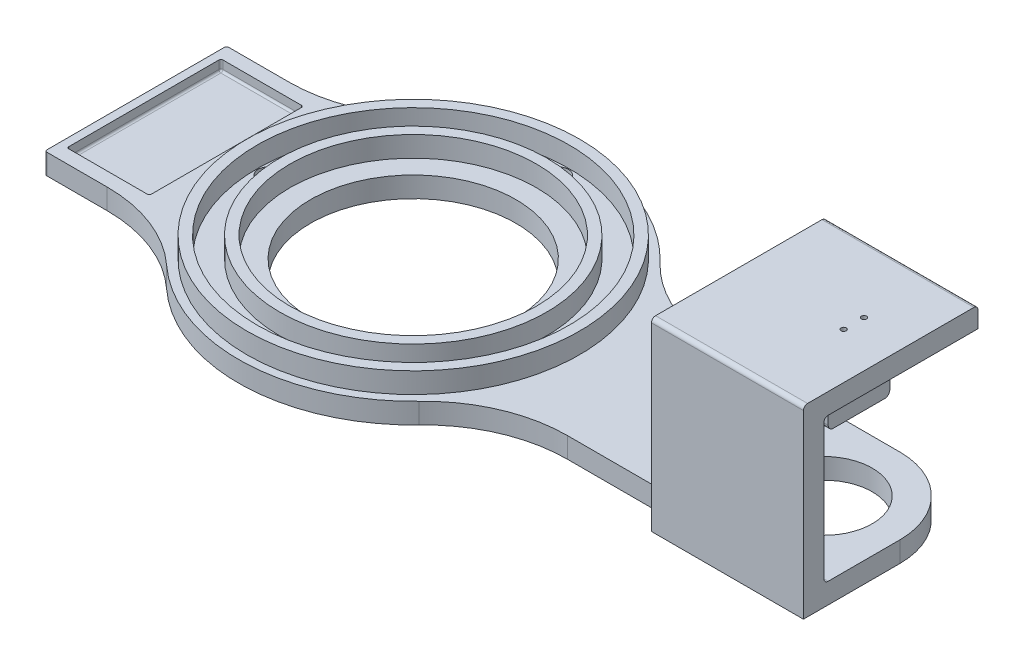
from build123d import *

# Parameters (mm, degrees)
CROQUIS1_R                   = 50
CROQUIS1_R_2                 = 23.5
SALIENTE_EXTRUIR1_DEPTH      = 10
REDONDEO1_R                  = 70
CROQUIS2_R                   = 81
CROQUIS2_R_2                 = 76
SALIENTE_EXTRUIR2_DEPTH      = 10
CROQUIS8_W                   = 74
CROQUIS8_H                   = 10
SALIENTE_EXTRUIR4_DEPTH      = 10
CROQUIS9_W                   = 74
CROQUIS9_H                   = 10
SALIENTE_EXTRUIR5_DEPTH      = 80
CROQUIS10_W                  = 74
CROQUIS10_H                  = 10
SALIENTE_EXTRUIR6_DEPTH      = 75
REDONDEO3_R                  = 2
REDONDEO4_R                  = 2
REDONDEO5_R                  = 2
REDONDEO6_R                  = 2
CROQUIS12_R                  = 65
CROQUIS12_R_2                = 60
SALIENTE_EXTRUIR12_DEPTH     = 10
CROQUIS13_R                  = 5
CORTAR_EXTRUIR1_DEPTH        = 10
SALIENTE_EXTRUIR13_OUTLINE_R = 1.25
SALIENTE_EXTRUIR13_DEPTH     = 26.7
REDONDEO7_R                  = 10
CORTAR_EXTRUIR2_START        = -36.7
CROQUIS15_R                  = 1.25
CORTAR_EXTRUIR2_DEPTH        = 36.7
REDONDEO9_R                  = 2.5
CROQUIS17_W                  = 7
CROQUIS17_H                  = 5
CORTAR_EXTRUIR3_DEPTH        = 26.95
CROQUIS18_W                  = 40.143208987
CROQUIS18_H                  = 75
CORTAR_EXTRUIR4_DEPTH        = 5
REDONDEO10_R                 = 1
REDONDEO11_R                 = 1


# Read off the part's stored shape, not the designer's step: Saliente-Extruir13
with BuildPart() as part:
    # Croquis1 → Saliente-Extruir1 (new body)
    with BuildSketch(Plane(origin=(0, 0, 0), x_dir=(1, 0, 0), z_dir=(0, 1, 0))):
        with BuildLine():
            ThreePointArc((-72.570488149, -44.255217205), (4.131356705, -84.899539997), (76.524505879, -37))
            Line((76.524505879, -37), (237, -37))
            Line((237, -37), (237, 0))
            ThreePointArc((237, 0), (226.162950904, 26.162950904), (200, 37))
            Line((200, 37), (76.524505879, 37))
            ThreePointArc((76.524505879, 37), (4.131356705, 84.899539997), (-72.570488149, 44.255217205))
            Line((-72.570488149, 44.255217205), (-135.143208987, 44.255217205))
            Line((-135.143208987, 44.255217205), (-135.143208987, -44.255217205))
            Line((-135.143208987, -44.255217205), (-72.570488149, -44.255217205))
        make_face()
        with Locations(Location((0, 0, 0), (0, 0, 270))):
            Circle(CROQUIS1_R, mode=Mode.SUBTRACT)
        with Locations(Location((200, 0, 0), (0, 0, 270))):
            Circle(CROQUIS1_R_2, mode=Mode.SUBTRACT)
    extrude(amount=SALIENTE_EXTRUIR1_DEPTH)

    # Redondeo1
    redondeo1_edges = [part.edges().sort_by_distance(p)[0] for p in [
        (76.524505879, 5, 37),
        (-72.570488149, 5, 44.255217205),
        (-72.570488149, 5, -44.255217205),
        (76.524505879, 5, -37),
    ]]
    fillet(redondeo1_edges, radius=REDONDEO1_R)

    # Croquis2 → Saliente-Extruir2 (add)
    with BuildSketch(Plane(origin=(0, 10, 0), x_dir=(1, 0, 0), z_dir=(0, 1, 0))):
        with Locations(Location((0, 0, 0), (0, 0, 270))):
            Circle(CROQUIS2_R)
        with Locations(Location((0, 0, 0), (0, 0, 270))):
            Circle(CROQUIS2_R_2, mode=Mode.SUBTRACT)
    extrude(amount=SALIENTE_EXTRUIR2_DEPTH)

    # Croquis8 → Saliente-Extruir4 (add)
    with BuildSketch(Plane.XY.offset(37)):
        with Locations((200, 5)):
            Rectangle(CROQUIS8_W, CROQUIS8_H)
    extrude(amount=SALIENTE_EXTRUIR4_DEPTH)

    # Croquis9 → Saliente-Extruir5 (add)
    with BuildSketch(Plane(origin=(0, 10, 0), x_dir=(1, 0, 0), z_dir=(0, 1, 0))):
        with Locations((200, -42)):
            Rectangle(CROQUIS9_W, CROQUIS9_H)
    extrude(amount=SALIENTE_EXTRUIR5_DEPTH)

    # Croquis10 → Saliente-Extruir6 (add)
    with BuildSketch(Plane(origin=(0, 0, 37), x_dir=(-1, 0, 0), z_dir=(0, 0, -1))):
        with Locations((-200, 85)):
            Rectangle(CROQUIS10_W, CROQUIS10_H)
    extrude(amount=SALIENTE_EXTRUIR6_DEPTH)

    # Redondeo3
    redondeo3_edges = [part.edges().sort_by_distance(p)[0] for p in [
        (200, 10, 37),
    ]]
    fillet(redondeo3_edges, radius=REDONDEO3_R)

    # Redondeo4
    redondeo4_edges = [part.edges().sort_by_distance(p)[0] for p in [
        (200, 80, 37),
    ]]
    fillet(redondeo4_edges, radius=REDONDEO4_R)

    # Redondeo5
    redondeo5_edges = [part.edges().sort_by_distance(p)[0] for p in [
        (200, 90, 47),
    ]]
    fillet(redondeo5_edges, radius=REDONDEO5_R)

    # Redondeo6
    redondeo6_edges = [part.edges().sort_by_distance(p)[0] for p in [
        (200, 90, -38),
    ]]
    fillet(redondeo6_edges, radius=REDONDEO6_R)

    # Croquis12 → Saliente-Extruir12 (add)
    with BuildSketch(Plane(origin=(0, 10, 0), x_dir=(1, 0, 0), z_dir=(0, 1, 0))):
        with Locations(Location((0, 0, 0), (0, 0, 270))):
            Circle(CROQUIS12_R)
        with Locations(Location((0, 0, 0), (0, 0, 270))):
            Circle(CROQUIS12_R_2, mode=Mode.SUBTRACT)
    extrude(amount=SALIENTE_EXTRUIR12_DEPTH)

    # Croquis13 → Cortar-Extruir1 (cut)
    with BuildSketch(Plane(origin=(0, 10, 0), x_dir=(1, 0, 0), z_dir=(0, 1, 0))):
        with Locations(Location((-70.5, 0, 0), (0, 0, 270))):
            Circle(CROQUIS13_R)
        with Locations(Location((0, 70.5, 0), (0, 0, 270))):
            Circle(CROQUIS13_R)
        with Locations(Location((70.5, 0, 0), (0, 0, 270))):
            Circle(CROQUIS13_R)
        with Locations(Location((0, -70.5, 0), (0, 0, 270))):
            Circle(CROQUIS13_R)
    extrude(amount=-CORTAR_EXTRUIR1_DEPTH, mode=Mode.SUBTRACT)

    # Saliente-Extruir13 outline → Saliente-Extruir13 (add)
    with BuildSketch(Plane.XZ.offset(-80)):
        Polygon((163, -10), (163, -15), (217.05, -15), (217.05, 15), (163, 15), (163, 10), (210.05, 10), (210.05, -10), align=None)
        with Locations((214.55, -4.95)):
            Circle(SALIENTE_EXTRUIR13_OUTLINE_R, mode=Mode.SUBTRACT)
        with Locations((214.55, 4.95)):
            Circle(SALIENTE_EXTRUIR13_OUTLINE_R, mode=Mode.SUBTRACT)
    extrude(amount=SALIENTE_EXTRUIR13_DEPTH)

    # Redondeo7
    redondeo7_edges = [part.edges().sort_by_distance(p)[0] for p in [
        (190.025, 80, -15),
        (190.025, 80, 15),
        (217.05, 80, 0),
    ]]
    fillet(redondeo7_edges, radius=REDONDEO7_R)

    # Croquis15 → Cortar-Extruir2 (cut)
    with BuildSketch(Plane.XZ.offset(-53.3).offset(CORTAR_EXTRUIR2_START)):
        with Locations(Location((214.55, 4.95, 0), (0, 0, 270))):
            Circle(CROQUIS15_R)
        with Locations(Location((214.55, -4.95, 0), (0, 0, 270))):
            Circle(CROQUIS15_R)
    extrude(amount=CORTAR_EXTRUIR2_DEPTH, mode=Mode.SUBTRACT)

    # Redondeo9
    redondeo9_edges = [part.edges().sort_by_distance(p)[0] for p in [
        (190.025, 53.3, 15),
        (190.025, 53.3, -15),
    ]]
    fillet(redondeo9_edges, radius=REDONDEO9_R)

    # Croquis17 → Cortar-Extruir3 (cut)
    with BuildSketch(Plane(origin=(237, 0, 0), x_dir=(0, 0, -1), z_dir=(1, 0, 0))):
        with Locations((0, 74.5)):
            Rectangle(CROQUIS17_W, CROQUIS17_H)
    extrude(amount=-CORTAR_EXTRUIR3_DEPTH, mode=Mode.SUBTRACT)

    # Croquis18 → Cortar-Extruir4 (cut)
    with BuildSketch(Plane(origin=(0, 10, 0), x_dir=(1, 0, 0), z_dir=(0, 1, 0))):
        with Locations((-111.071604494, 0.005217205)):
            Rectangle(CROQUIS18_W, CROQUIS18_H)
    extrude(amount=-CORTAR_EXTRUIR4_DEPTH, mode=Mode.SUBTRACT)

    # Redondeo10
    redondeo10_edges = [part.edges().sort_by_distance(p)[0] for p in [
        (-91, 7.5, -37.505217205),
        (-111.071604493, 5, 37.494782795),
        (-91, 7.5, 37.494782795),
        (-131.143208987, 5, -0.005217205),
        (-131.143208987, 7.5, 37.494782795),
        (-131.143208987, 7.5, -37.505217205),
        (-91, 5, -0.005217205),
        (-111.071604493, 5, -37.505217205),
    ]]
    fillet(redondeo10_edges, radius=REDONDEO10_R)

    # Redondeo11
    redondeo11_edges = [part.edges().sort_by_distance(p)[0] for p in [
        (-135.143208987, 5, -44.255217205),
        (-135.143208987, 5, 44.255217205),
    ]]
    fillet(redondeo11_edges, radius=REDONDEO11_R)


solid = part.part
